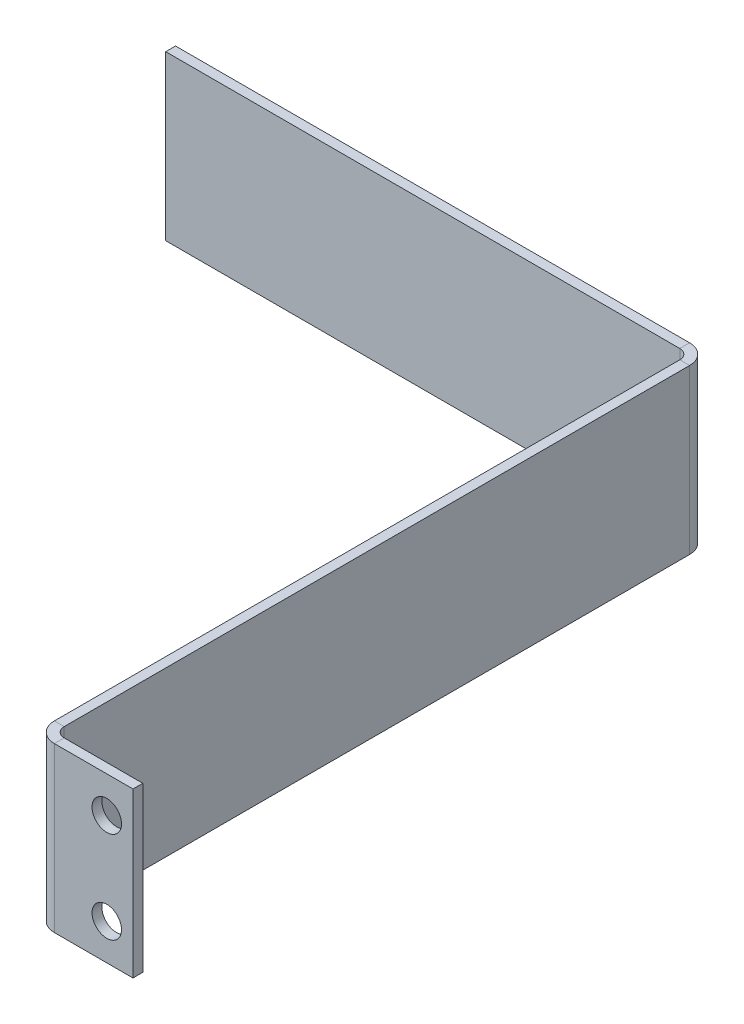
from build123d import *

# Parameters (mm, degrees)
BASE_FLANGE1_DEPTH   = 12.5
M4_CLEARANCE_HOLE1_D = 4.5


# Sheet-metal steps are written as plain solids
with BuildPart() as part:
    # Sketch1 → Base-Flange1 (new, symmetric)
    with BuildSketch(Plane(origin=(0, 0, 0), x_dir=(1, 0, 0), z_dir=(0, 1, 0))):
        with BuildLine():
            Line((0, 0), (-12, 0))
            ThreePointArc((-12, 0), (-14.121320344, 0.878679656), (-15, 3))
            Line((-15, 3), (-15, 98.5))
            ThreePointArc((-15, 98.5), (-15.439339828, 99.560660172), (-16.5, 100))
            Line((-16.5, 100), (-95, 100))
            Line((-95, 100), (-95, 101.5))
            Line((-95, 101.5), (-16.5, 101.5))
            ThreePointArc((-16.5, 101.5), (-14.378679656, 100.621320344), (-13.5, 98.5))
            Line((-13.5, 98.5), (-13.5, 3))
            ThreePointArc((-13.5, 3), (-13.060660172, 1.939339828), (-12, 1.5))
            Line((-12, 1.5), (0, 1.5))
            Line((0, 1.5), (0, 0))
        make_face()
    extrude(amount=BASE_FLANGE1_DEPTH, both=True)

    # M4 Clearance Hole1 (through all)
    with Locations(Plane.XY):
        with Locations((-4, 7), (-4, -7)):
            Hole(M4_CLEARANCE_HOLE1_D / 2)


solid = part.part
